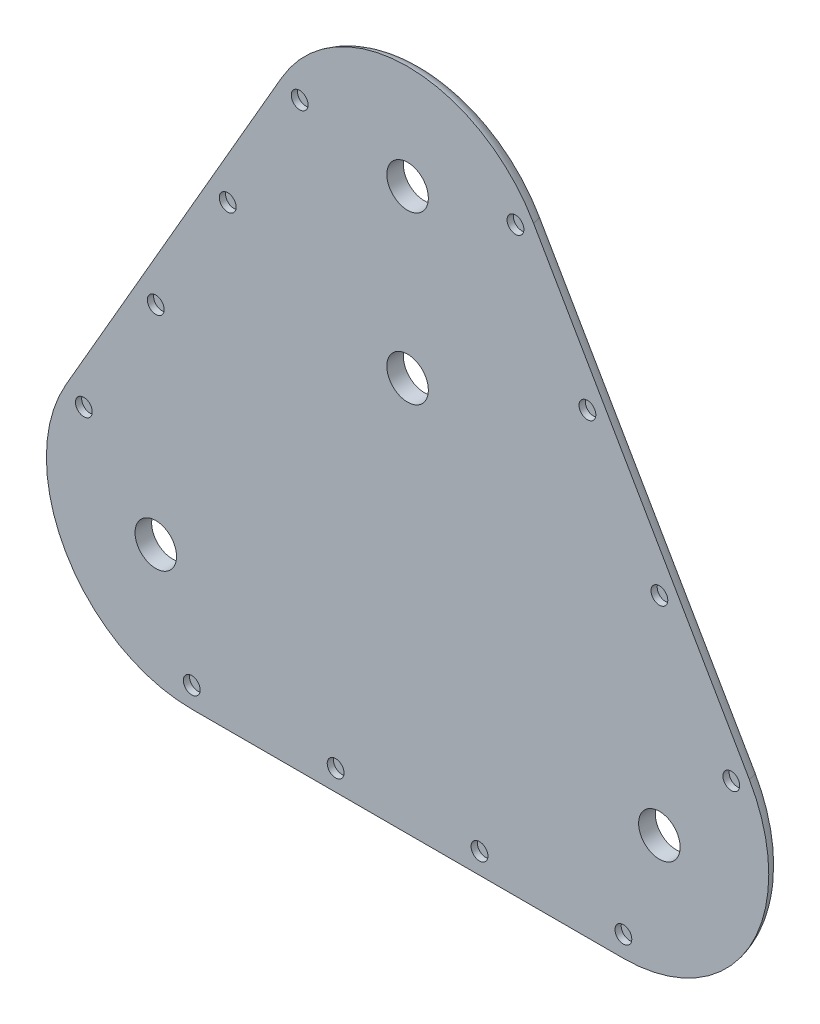
from build123d import *

# Parameters (mm, degrees)
RESSALTO_EXTRUS_O1_DEPTH = 4
ESBO_O2_R                = 5
CORTE_EXTRUS_O1_DEPTH    = 4
ESBO_O3_R                = 2.025
CORTE_EXTRUS_O2_DEPTH    = 1.5
FILETE1_R                = 5


with BuildPart() as part:
    # Esboço1 → Ressalto-extrusão1 (new body)
    with BuildSketch(Plane.XY):
        with BuildLine():
            Line((-30.310889132, 77.5), (-82.27241336, -12.5))
            ThreePointArc((-82.27241336, -12.5), (-82.27241336, -47.5), (-51.961524227, -65))
            Line((-51.961524227, -65), (51.961524227, -65))
            ThreePointArc((51.961524227, -65), (82.27241336, -47.5), (82.27241336, -12.5))
            Line((82.27241336, -12.5), (30.310889132, 77.5))
            ThreePointArc((30.310889132, 77.5), (0, 95), (-30.310889132, 77.5))
        make_face()
    extrude(amount=RESSALTO_EXTRUS_O1_DEPTH)

    # Esboço2 → Corte-extrusão1 (cut)
    with BuildSketch(Plane.XY):
        with Locations((0, 70)):
            Circle(ESBO_O2_R)
        with Locations((60.621778265, -35)):
            Circle(ESBO_O2_R)
        with Locations((-60.621778265, -35)):
            Circle(ESBO_O2_R)
        with Locations((0, 30)):
            Circle(ESBO_O2_R)
    extrude(amount=CORTE_EXTRUS_O1_DEPTH, mode=Mode.SUBTRACT)

    # Esboço3 → Corte-extrusão2 (cut)
    with BuildSketch(Plane.XY.offset(4)):
        with Locations((-77.942286341, -15)):
            Circle(ESBO_O3_R)
        with Locations((-51.961524227, -60)):
            Circle(ESBO_O3_R)
        with Locations((77.942286341, -15)):
            Circle(ESBO_O3_R)
        with Locations((-60.622286341, 14.999119987)):
            Circle(ESBO_O3_R)
        with Locations((-43.302286341, 44.998239974)):
            Circle(ESBO_O3_R)
        with Locations((-25.982286341, 74.997359961)):
            Circle(ESBO_O3_R)
        with Locations((60.622286341, 14.999119987)):
            Circle(ESBO_O3_R)
        with Locations((43.302286341, 44.998239974)):
            Circle(ESBO_O3_R)
        with Locations((25.982286341, 74.997359961)):
            Circle(ESBO_O3_R)
        with Locations((-17.321524227, -60)):
            Circle(ESBO_O3_R)
        with Locations((17.318475773, -60)):
            Circle(ESBO_O3_R)
        with Locations((51.958475773, -60)):
            Circle(ESBO_O3_R)
    extrude(amount=-CORTE_EXTRUS_O2_DEPTH, mode=Mode.SUBTRACT)

    # Filete1
    # the kernel refuses this fillet: 5 mm, written as the material it takes off along each edge
    with BuildSketch(Plane(origin=(-51.961524227, -30, 0), x_dir=(-0.8660254037844398, 0.49999999999999795, 0), z_dir=(0.49999999999999795, 0.8660254037844398, 0))) as filete1_piece_1:
        with BuildLine():
            CenterArc((30.101020514, 5), FILETE1_R, 270, 78.463040967)
            Line((35, 4), (35.09797959, 3.98))
            ThreePointArc((35.09797959, 3.98), (35.1, 2), (35.1, 0))
            Line((35.1, 0), (35, -0.1))
            Line((35, -0.1), (30.101020514, -0.1))
            Line((30.101020514, -0.1), (30.101020514, 0))
        make_face()
    revolve(axis=Axis((-51.961524227, -30, 0), (0, 0, 1)), revolution_arc=120, mode=Mode.SUBTRACT)
    with BuildSketch(Plane(origin=(-30.310889132, 77.5, 0), x_dir=(0.8660254037844398, -0.4999999999999981, 0), z_dir=(-0.4999999999999981, -0.8660254037844398, 0)), Plane(origin=(-51.961524227, -65, 0), x_dir=(0, 1, 0), z_dir=(1, 0, 0))) as filete1_piece_2:
        with BuildLine():
            CenterArc((4.898979486, 5), FILETE1_R, 191.536959033, 78.463040967)
            Line((0, 4), (-0.09797959, 3.98))
            ThreePointArc((-0.09797959, 3.98), (-0.1, 2), (-0.1, 0))
            Line((-0.1, 0), (0, -0.1))
            Line((0, -0.1), (4.898979486, -0.1))
            Line((4.898979486, -0.1), (4.898979486, 0))
        make_face()
    extrude(amount=103.923048454, mode=Mode.SUBTRACT)
    with BuildSketch(Plane(origin=(0, 60, 0), x_dir=(0.8660254037844363, 0.5000000000000041, 0), z_dir=(0.5000000000000041, -0.8660254037844363, 0))) as filete1_piece_3:
        with BuildLine():
            CenterArc((30.101020514, 5), FILETE1_R, 270, 78.463040967)
            Line((30.101020514, 0), (30.101020514, -0.1))
            Line((30.101020514, -0.1), (35, -0.1))
            Line((35, -0.1), (35.1, 0))
            ThreePointArc((35.1, 0), (35.1, 2), (35.09797959, 3.98))
            Line((35.09797959, 3.98), (35, 4))
        make_face()
    revolve(axis=Axis((0, 60, 0), (0, 0, 1)), revolution_arc=120, mode=Mode.SUBTRACT)
    with BuildSketch(Plane(origin=(82.27241336, -12.5, 0), x_dir=(-1.3637382312526318e-12, -7.873546349178999e-13, 1.0), z_dir=(-0.5000000000000043, 0.8660254037844363, 0))) as filete1_piece_4:
        with BuildLine():
            CenterArc((5, -4.898979486), FILETE1_R, 101.536959033, 78.463040967)
            Line((0, -4.898979486), (-0.1, -4.898979486))
            Line((-0.1, -4.898979486), (-0.1, 0))
            Line((-0.1, 0), (0, 0.1))
            ThreePointArc((0, 0.1), (2, 0.1), (3.98, 0.09797959))
            Line((3.98, 0.09797959), (4, 0))
        make_face()
    extrude(amount=103.923048454, mode=Mode.SUBTRACT)
    with BuildSketch(Plane(origin=(51.961524227, -30, 0), x_dir=(0, -1, 0), z_dir=(-1, 0, 0))) as filete1_piece_5:
        with BuildLine():
            CenterArc((30.101020514, 5), FILETE1_R, 270, 78.463040967)
            Line((30.101020514, 0), (30.101020514, -0.1))
            Line((30.101020514, -0.1), (35, -0.1))
            Line((35, -0.1), (35.1, 0))
            ThreePointArc((35.1, 0), (35.1, 2), (35.09797959, 3.98))
            Line((35.09797959, 3.98), (35, 4))
        make_face()
    revolve(axis=Axis((51.961524227, -30, 0), (0, 0, 1)), revolution_arc=120, mode=Mode.SUBTRACT)


solid = part.part
